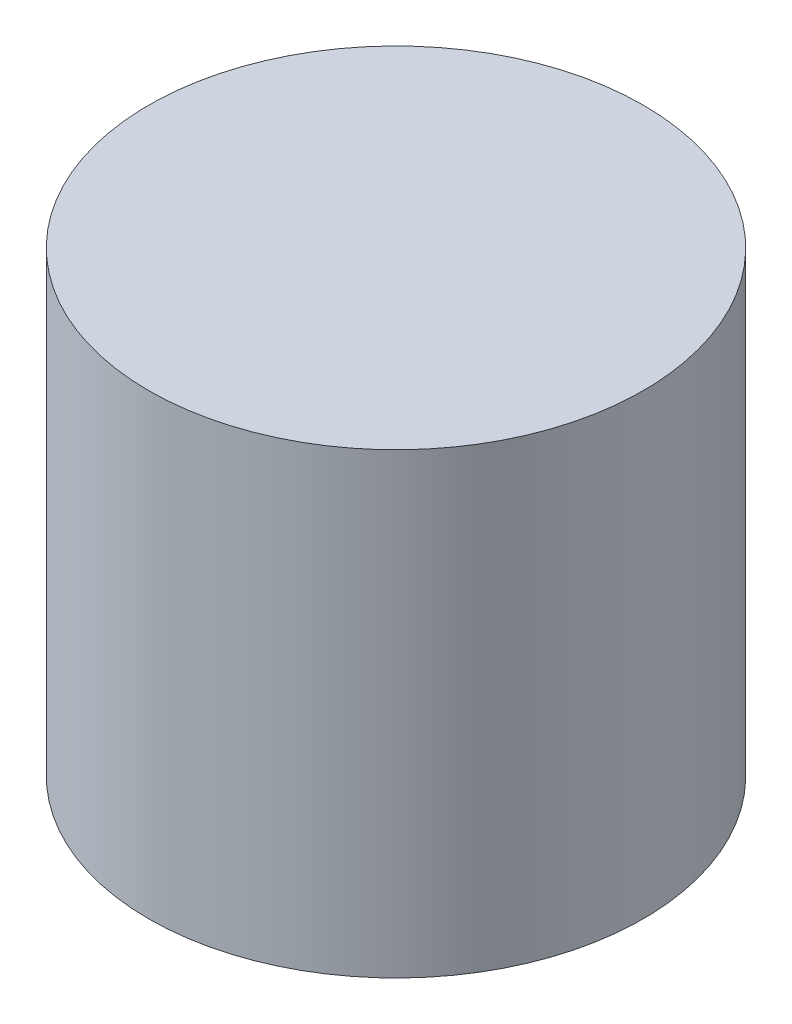
from build123d import *

# Parameters (mm, degrees)
SKETCH1_R           = 10
BOSS_EXTRUDE1_DEPTH = 18.5


with BuildPart() as part:
    # Sketch1 → Boss-Extrude1 (new body)
    with BuildSketch(Plane(origin=(0, 0, 0), x_dir=(1, 0, 0), z_dir=(0, 1, 0))):
        Circle(SKETCH1_R)
    extrude(amount=BOSS_EXTRUDE1_DEPTH)


solid = part.part
